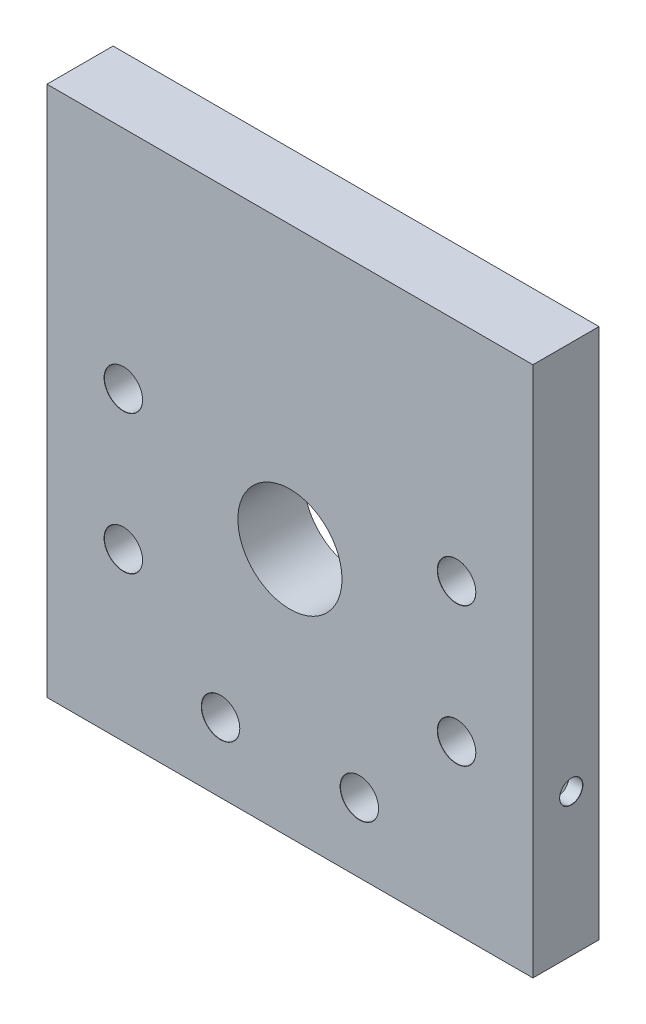
from build123d import *

# Parameters (mm, degrees)
SKETCH1_W                             = 70
SKETCH1_H                             = 130
BOSS_EXTRUDE1_DEPTH                   = 9.525
TAP_DRILL_FOR_M4X0_7_TAP1_D           = 3.3
TAP_DRILL_FOR_M4X0_7_TAP1_DEPTH       = 2
TAP_DRILL_FOR_M4X0_7_TAP1_CSINK_D     = 3.35
TAP_DRILL_FOR_M4X0_7_TAP1_CSINK_ANGLE = 90
TAP_DRILL_FOR_M4X0_7_TAP1_TIP         = 0.991420021
SKETCH6_R                             = 7.5
CUT_EXTRUDE1_DEPTH                    = 75.436050574
M5_CLEARANCE_HOLE1_D                  = 5.5
M5_CLEARANCE_HOLE1_CSINK_D            = 5.55
M5_CLEARANCE_HOLE1_CSINK_ANGLE        = 90
SKETCH17_W                            = 118.430226537
SKETCH17_H                            = 66.328511545
CUT_EXTRUDE2_DEPTH                    = 75.436050574


with BuildPart() as part:
    # Sketch1 → Boss-Extrude1 (new body)
    with BuildSketch(Plane.XY):
        Rectangle(SKETCH1_W, SKETCH1_H)
    extrude(amount=BOSS_EXTRUDE1_DEPTH)

    # Tap Drill for M4x0.7 Tap1
    with Locations(Plane(origin=(0, -65, 0), x_dir=(-1, 0, 0), z_dir=(0, -1, 0))):
        with Locations((20, -4.7625), (-20, -4.7625)):
            CounterSinkHole(TAP_DRILL_FOR_M4X0_7_TAP1_D / 2, TAP_DRILL_FOR_M4X0_7_TAP1_CSINK_D / 2, depth=TAP_DRILL_FOR_M4X0_7_TAP1_DEPTH, counter_sink_angle=TAP_DRILL_FOR_M4X0_7_TAP1_CSINK_ANGLE)
            with Locations((0, 0, -(TAP_DRILL_FOR_M4X0_7_TAP1_DEPTH + TAP_DRILL_FOR_M4X0_7_TAP1_TIP / 2))):  # 118° drill point
                Cone(0, TAP_DRILL_FOR_M4X0_7_TAP1_D / 2, TAP_DRILL_FOR_M4X0_7_TAP1_TIP, mode=Mode.SUBTRACT)

    # Sketch6 → Cut-Extrude1 (cut, through all)
    with BuildSketch(Plane.XY.offset(9.525)):
        with Locations((0, 29)):
            Circle(SKETCH6_R)
    cut_extrude1 = extrude(amount=-CUT_EXTRUDE1_DEPTH, mode=Mode.SUBTRACT)

    # M5 Clearance Hole1 (through all)
    with Locations(Plane.XY.offset(9.525)):
        with Locations((-10, 55), (10, 55), (24, 41), (24, 21), (-24, 41), (-24, 21)):
            m5_clearance_hole1 = CounterSinkHole(M5_CLEARANCE_HOLE1_D / 2, M5_CLEARANCE_HOLE1_CSINK_D / 2, counter_sink_angle=M5_CLEARANCE_HOLE1_CSINK_ANGLE)

    # Sketch16 → Tap Drill for M4x0.7 Tap2 (revolve, cut)
    with BuildSketch(Plane(origin=(35, -44.5, 4), x_dir=(0, 0, -1), z_dir=(0, 1, 0))):
        Polygon((0, 0), (0, 2.991420021), (1.65, 2), (1.65, 0.025), (1.675, 0), align=None)
    tap_drill_for_m4x0_7_tap2 = revolve(axis=Axis((41.35, -44.5, 4), (-1, 0, 0)), mode=Mode.SUBTRACT)

    # Mirror1: Tap Drill for M4x0.7 Tap2 across plane
    add(tap_drill_for_m4x0_7_tap2.mirror(Plane(origin=(0, 0, 0), x_dir=(0, 0, 1), z_dir=(1, 0, 0))), mode=Mode.SUBTRACT)

    # Mirror3: Cut-Extrude1, M5 Clearance Hole1 across plane
    add(cut_extrude1.mirror(Plane.ZX), mode=Mode.SUBTRACT)
    add(m5_clearance_hole1.mirror(Plane.ZX), mode=Mode.SUBTRACT)

    # Sketch17 → Cut-Extrude2 (cut, through all)
    with BuildSketch(Plane.XY.offset(9.525)):
        with Locations((0.76574511, 44.669822945)):
            Rectangle(SKETCH17_W, SKETCH17_H)
    extrude(amount=-CUT_EXTRUDE2_DEPTH, mode=Mode.SUBTRACT)


solid = part.part
